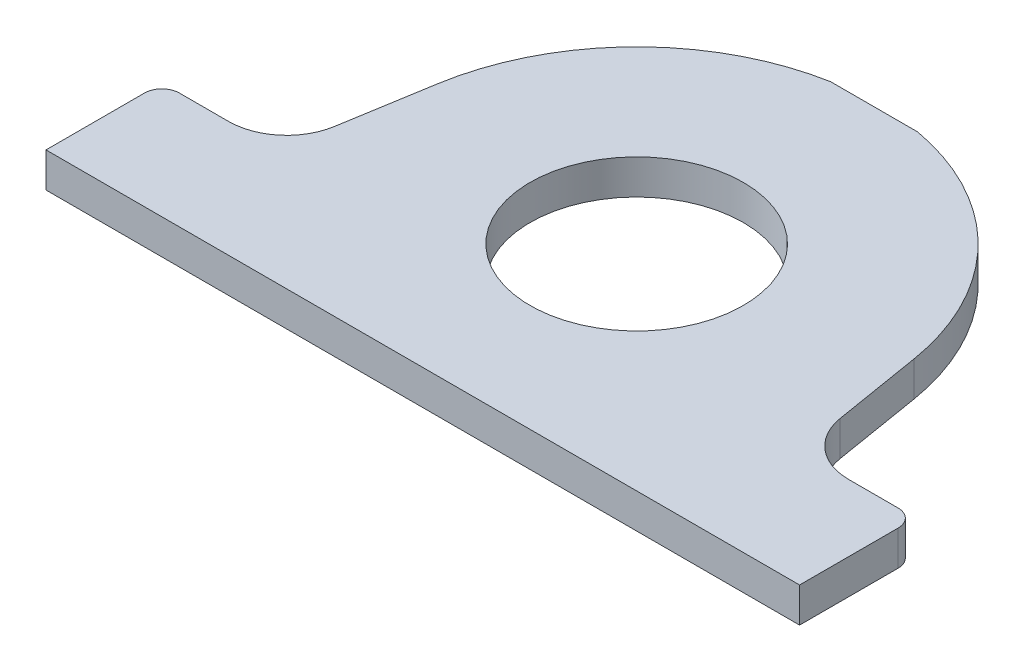
from build123d import *

# Parameters (mm, degrees)
SKETCH1_R           = 20.9
BOSS_EXTRUDE1_DEPTH = 30
SKETCH2_R           = 1
CUT_EXTRUDE1_DEPTH  = 3
SKETCH3_R           = 1
CUT_EXTRUDE2_DEPTH  = 3
SKETCH6_R           = 22.9
SKETCH6_R_2         = 18.4
BOSS_EXTRUDE2_DEPTH = 12
FILLET1_R           = 10
CHAMFER1_SIZE       = 2
SKETCH4_W           = 15
SKETCH4_H           = 3.988700157
CUT_EXTRUDE3_DEPTH  = 83.82344173
SKETCH8_R           = 1
CUT_EXTRUDE4_DEPTH  = 2
FILLET2_R           = 3
FILLET3_R           = 3
SKETCH9_W           = 164.009429166
SKETCH9_H           = 28.275732928
CUT_EXTRUDE5_DEPTH  = 93


with BuildPart() as part:
    # Sketch1 → Boss-Extrude1 (new body)
    with BuildSketch(Plane(origin=(0, 0, 0), x_dir=(1, 0, 0), z_dir=(0, 1, 0))):
        with BuildLine():
            Line((-41.094820281, 6.777775896), (-45, -16.9))
            Line((-45, -16.9), (-65, -16.9))
            Line((-65, -16.9), (-65, -36.9))
            Line((-65, -36.9), (65, -36.9))
            Line((65, -36.9), (65, -16.9))
            Line((65, -16.9), (45, -16.9))
            Line((45, -16.9), (41.094820281, 6.777775896))
            ThreePointArc((41.094820281, 6.777775896), (0, 41.65), (-41.094820281, 6.777775896))
        make_face()
        with Locations(Location((0, 0, 0), (0, 0, 270))):
            Circle(SKETCH1_R, mode=Mode.SUBTRACT)
    extrude(amount=BOSS_EXTRUDE1_DEPTH)

    # Sketch2 → Cut-Extrude1 (cut)
    with BuildSketch(Plane(origin=(0, 0, 16.9), x_dir=(-1, 0, 0), z_dir=(0, 0, -1))):
        with Locations((-55, 15)):
            Circle(SKETCH2_R)
    extrude(amount=-CUT_EXTRUDE1_DEPTH, mode=Mode.SUBTRACT)

    # Sketch3 → Cut-Extrude2 (cut)
    with BuildSketch(Plane(origin=(0, 0, 16.9), x_dir=(-1, 0, 0), z_dir=(0, 0, -1))):
        with Locations((55, 15)):
            Circle(SKETCH3_R)
    extrude(amount=-CUT_EXTRUDE2_DEPTH, mode=Mode.SUBTRACT)

    # Sketch6 → Boss-Extrude2 (add)
    with BuildSketch(Plane.XZ):
        Circle(SKETCH6_R)
        with Locations(Location((0, 0, 0), (0, 0, 270))):
            Circle(SKETCH6_R_2, mode=Mode.SUBTRACT)
    extrude(amount=-BOSS_EXTRUDE2_DEPTH)

    # Fillet1
    fillet1_edges = [part.edges().sort_by_distance(p)[0] for p in [
        (-45, 15, 16.9),
        (45, 15, 16.9),
    ]]
    fillet(fillet1_edges, radius=FILLET1_R)

    # Chamfer1
    chamfer1_edges = [part.edges().sort_by_distance(p)[0] for p in [
        (0, 30, -20.9),
    ]]
    chamfer(chamfer1_edges, length=CHAMFER1_SIZE)

    # Sketch4 → Cut-Extrude3 (cut, through all)
    with BuildSketch(Plane.XZ):
        with Locations((0, -42.963515313)):
            Rectangle(SKETCH4_W, SKETCH4_H)
    extrude(amount=-CUT_EXTRUDE3_DEPTH, mode=Mode.SUBTRACT)

    # Sketch8 → Cut-Extrude4 (cut)
    with BuildSketch(Plane(origin=(0, 0, -40.969165234), x_dir=(-1, 0, 0), z_dir=(0, 0, -1))):
        with Locations((0, 22)):
            Circle(SKETCH8_R)
    extrude(amount=-CUT_EXTRUDE4_DEPTH, mode=Mode.SUBTRACT)

    # Fillet2
    # the kernel refuses this fillet: 3 mm, written as the material it takes off along each edge
    with BuildSketch(Plane(origin=(83, 30, 16.9), x_dir=(0, 0, 1), z_dir=(-1, 0, 0)), Plane(origin=(-53.485795501, 30, 16.9), x_dir=(0, 0, 1), z_dir=(-1, 0, 0))) as fillet2_piece_1:
        with BuildLine():
            CenterArc((FILLET2_R, -FILLET2_R), FILLET2_R, 90, 90)
            Line((0, -FILLET2_R), (-FILLET2_R * 0.02, -FILLET2_R))
            Line((-FILLET2_R * 0.02, -FILLET2_R), (-FILLET2_R * 0.02, FILLET2_R * 0.02))
            Line((-FILLET2_R * 0.02, FILLET2_R * 0.02), (FILLET2_R, FILLET2_R * 0.02))
            Line((FILLET2_R, FILLET2_R * 0.02), (FILLET2_R, 0))
        make_face()
    extrude(amount=29.514204499, mode=Mode.SUBTRACT)
    with BuildSketch(Plane(origin=(53.485795501, 30, 6.9), x_dir=(-0.9866703548806417, 0, 0.1627317141792235), z_dir=(-0.1627317141792235, 0, -0.9866703548806417))) as fillet2_piece_2:
        with BuildLine():
            CenterArc((10 + FILLET2_R, -FILLET2_R), FILLET2_R, 90, 90)
            Line((10, -FILLET2_R), (10 - FILLET2_R * 0.02, -FILLET2_R))
            Line((10 - FILLET2_R * 0.02, -FILLET2_R), (10 - FILLET2_R * 0.02, FILLET2_R * 0.02))
            Line((10 - FILLET2_R * 0.02, FILLET2_R * 0.02), (10 + FILLET2_R, FILLET2_R * 0.02))
            Line((10 + FILLET2_R, FILLET2_R * 0.02), (10 + FILLET2_R, 0))
        make_face()
    revolve(axis=Axis((53.485795501, 30, 6.9), (0, 1, 0)), revolution_arc=80.6345096, mode=Mode.SUBTRACT)
    with BuildSketch(Plane(origin=(43.619091952, 30, 8.527317142), x_dir=(-0.9866703548806418, 0, 0.16273171417922358), z_dir=(-0.16273171417922358, 0, -0.9866703548806418)), Plane(origin=(-41.094820281, 30, -6.777775896), x_dir=(0.9866703548806418, 0, 0.16273171417922358), z_dir=(-0.16273171417922358, 0, 0.9866703548806418))) as fillet2_piece_3:
        with BuildLine():
            CenterArc((FILLET2_R, -FILLET2_R), FILLET2_R, 90, 90)
            Line((0, -FILLET2_R), (-FILLET2_R * 0.02, -FILLET2_R))
            Line((-FILLET2_R * 0.02, -FILLET2_R), (-FILLET2_R * 0.02, FILLET2_R * 0.02))
            Line((-FILLET2_R * 0.02, FILLET2_R * 0.02), (FILLET2_R, FILLET2_R * 0.02))
            Line((FILLET2_R, FILLET2_R * 0.02), (FILLET2_R, 0))
        make_face()
    extrude(amount=15.511860635, mode=Mode.SUBTRACT)
    with BuildSketch(Plane(origin=(-53.485795501, 30, 6.9), x_dir=(0.9866703548806417, 0, 0.1627317141792235), z_dir=(0.1627317141792235, 0, -0.9866703548806417))) as fillet2_piece_4:
        with BuildLine():
            CenterArc((10 + FILLET2_R, FILLET2_R), FILLET2_R, 180, 90)
            Line((10, FILLET2_R), (10 - FILLET2_R * 0.02, FILLET2_R))
            Line((10 - FILLET2_R * 0.02, FILLET2_R), (10 - FILLET2_R * 0.02, -FILLET2_R * 0.02))
            Line((10 - FILLET2_R * 0.02, -FILLET2_R * 0.02), (10 + FILLET2_R, -FILLET2_R * 0.02))
            Line((10 + FILLET2_R, -FILLET2_R * 0.02), (10 + FILLET2_R, 0))
        make_face()
    revolve(axis=Axis((-53.485795501, 30, 6.9), (0, -1, 0)), revolution_arc=80.6345096, mode=Mode.SUBTRACT)
    with BuildSketch(Plane(origin=(0, 30, 0), x_dir=(0.24858486581871286, 0, -0.9686101199584343), z_dir=(0.9686101199584343, 0, 0.24858486581871286))) as fillet2_piece_5:
        with BuildLine():
            CenterArc((41.65 - FILLET2_R, -FILLET2_R), FILLET2_R, 0, 90)
            Line((41.65, -FILLET2_R), (41.65 + FILLET2_R * 0.02, -FILLET2_R))
            Line((41.65 + FILLET2_R * 0.02, -FILLET2_R), (41.65 + FILLET2_R * 0.02, FILLET2_R * 0.02))
            Line((41.65 + FILLET2_R * 0.02, FILLET2_R * 0.02), (41.65 - FILLET2_R, FILLET2_R * 0.02))
            Line((41.65 - FILLET2_R, FILLET2_R * 0.02), (41.65 - FILLET2_R, 0))
        make_face()
    revolve(axis=Axis((0, 30, 0), (0, 1, 0)), revolution_arc=95.028297231, mode=Mode.SUBTRACT)
    with BuildSketch(Plane(origin=(0, 30, 0), x_dir=(0.9866703548806417, 0, -0.16273171417922386), z_dir=(0.16273171417922386, 0, 0.9866703548806417))) as fillet2_piece_6:
        with BuildLine():
            CenterArc((41.65 - FILLET2_R, -FILLET2_R), FILLET2_R, 0, 90)
            Line((41.65, -FILLET2_R), (41.65 + FILLET2_R * 0.02, -FILLET2_R))
            Line((41.65 + FILLET2_R * 0.02, -FILLET2_R), (41.65 + FILLET2_R * 0.02, FILLET2_R * 0.02))
            Line((41.65 + FILLET2_R * 0.02, FILLET2_R * 0.02), (41.65 - FILLET2_R, FILLET2_R * 0.02))
            Line((41.65 - FILLET2_R, FILLET2_R * 0.02), (41.65 - FILLET2_R, 0))
        make_face()
    revolve(axis=Axis((0, 30, 0), (0, 1, 0)), revolution_arc=95.028297231, mode=Mode.SUBTRACT)

    # Fillet3
    fillet3_edges = [part.edges().sort_by_distance(p)[0] for p in [
        (65, 30, 28.4),
        (-65, 30, 28.4),
        (65, 13.5, 16.9),
        (65, 29.121320344, 17.778679656),
        (-65, 13.5, 16.9),
        (-65, 29.121320344, 17.778679656),
    ]]
    fillet(fillet3_edges, radius=FILLET3_R)

    # Sketch9 → Cut-Extrude5 (cut)
    with BuildSketch(Plane.XY.offset(36.9)):
        with Locations((5.097067232, 20.137866464)):
            Rectangle(SKETCH9_W, SKETCH9_H)
    extrude(amount=-CUT_EXTRUDE5_DEPTH, mode=Mode.SUBTRACT)


solid = part.part
